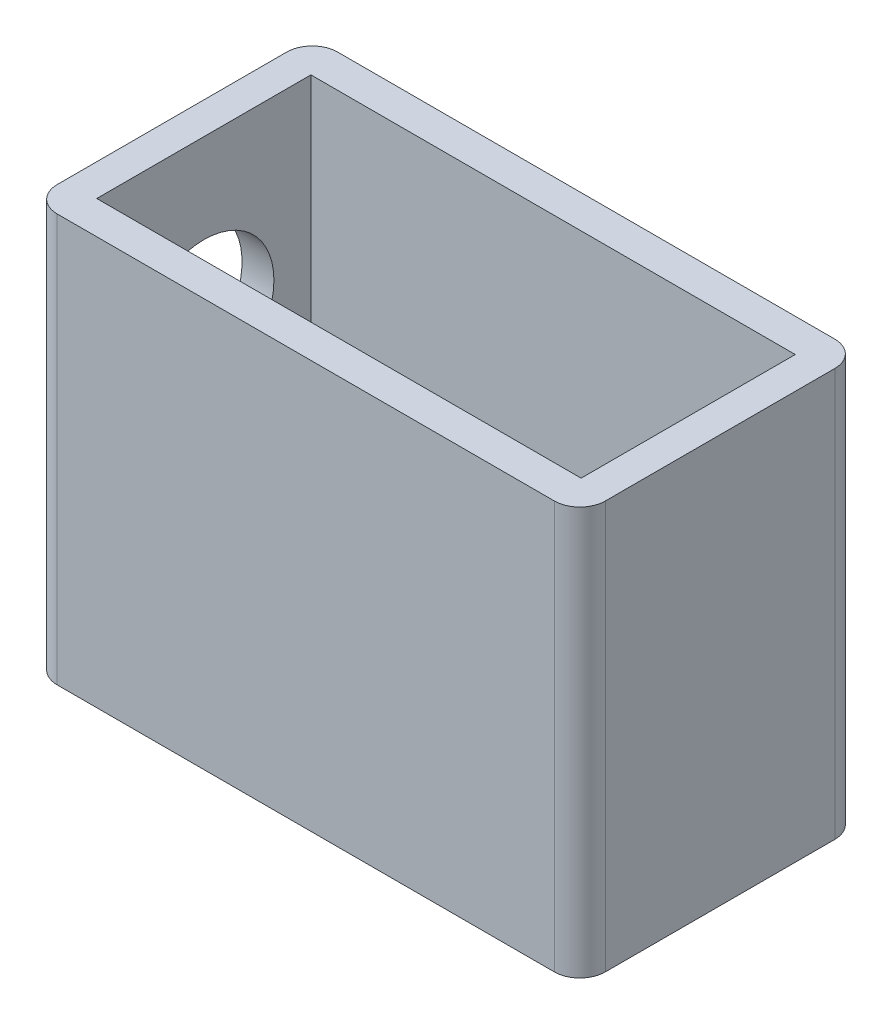
from build123d import *

# Parameters (mm, degrees)
BOSS_EXTRUDE1_DEPTH = 2
SKETCH2_W           = 18.8
SKETCH2_H           = 15.2
SKETCH2_W_2         = 15.8
SKETCH2_H_2         = 15.8
CUT_EXTRUDE1_DEPTH  = 1.4
SKETCH3_W           = 16.8
SKETCH3_H           = 13.2
SKETCH3_W_2         = 13.8
SKETCH3_H_2         = 13.8
CUT_EXTRUDE2_DEPTH  = 25.191114071
BOSS_EXTRUDE3_DEPTH = 30
FILLET1_R           = 10
SKETCH15_W          = 38
SKETCH15_H          = 16.8
CUT_EXTRUDE3_DEPTH  = 39.512984823
CUT_EXTRUDE4_REACH  = 56.717
SKETCH16_R          = 5.5


with BuildPart() as part:
    # Sketch1 → Boss-Extrude1 (new body)
    with BuildSketch(Plane(origin=(0, 0, 0), x_dir=(1, 0, 0), z_dir=(0, 1, 0))):
        with BuildLine():
            Line((19.5, -11), (-19.5, -11))
            ThreePointArc((-19.5, -11), (-20.914213562, -10.414213562), (-21.5, -9))
            Line((-21.5, -9), (-21.5, 9))
            ThreePointArc((-21.5, 9), (-20.914213562, 10.414213562), (-19.5, 11))
            Line((-19.5, 11), (19.5, 11))
            ThreePointArc((19.5, 11), (20.914213562, 10.414213562), (21.5, 9))
            Line((21.5, 9), (21.5, -9))
            ThreePointArc((21.5, -9), (20.914213562, -10.414213562), (19.5, -11))
        make_face()
    extrude(amount=BOSS_EXTRUDE1_DEPTH)

    # Sketch2 → Cut-Extrude1 (cut)
    with BuildSketch(Plane(origin=(0, 2, 0), x_dir=(1, 0, 0), z_dir=(0, 1, 0))):
        with Locations((-8.4, -0.4)):
            Rectangle(SKETCH2_W, SKETCH2_H)
        with Locations((9.9, -0.1)):
            Rectangle(SKETCH2_W_2, SKETCH2_H_2)
    extrude(amount=-CUT_EXTRUDE1_DEPTH, mode=Mode.SUBTRACT)

    # Sketch3 → Cut-Extrude2 (cut, through all)
    with BuildSketch(Plane(origin=(0, 0.6, 0), x_dir=(1, 0, 0), z_dir=(0, 1, 0))):
        with Locations((-8.4, -0.4)):
            Rectangle(SKETCH3_W, SKETCH3_H)
        with Locations((9.9, -0.1)):
            Rectangle(SKETCH3_W_2, SKETCH3_H_2)
    extrude(amount=-CUT_EXTRUDE2_DEPTH, mode=Mode.SUBTRACT)

    # Sketch13 → Boss-Extrude3 (add)
    with BuildSketch(Plane(origin=(0, 2, 0), x_dir=(1, 0, 0), z_dir=(0, 1, 0))):
        with BuildLine():
            ThreePointArc((-21.5, -9), (-20.914213562, -10.414213562), (-19.5, -11))
            Line((-19.5, -11), (19.5, -11))
            ThreePointArc((19.5, -11), (20.914213562, -10.414213562), (21.5, -9))
            Line((21.5, -9), (21.5, 9))
            ThreePointArc((21.5, 9), (20.914213562, 10.414213562), (19.5, 11))
            Line((19.5, 11), (-19.5, 11))
            ThreePointArc((-19.5, 11), (-20.914213562, 10.414213562), (-21.5, 9))
            Line((-21.5, 9), (-21.5, -9))
        make_face()
        with BuildLine():
            ThreePointArc((17.5, 8), (18.207106781, 7.707106781), (18.5, 7))
            Line((18.5, 7), (18.5, -7))
            ThreePointArc((18.5, -7), (18.306225775, -7.591607978), (17.8, -7.953939201))
            Line((17.8, -7.953939201), (17.8, -8))
            Line((17.8, -8), (-17.8, -8))
            Line((-17.8, -8), (-17.8, -7.953939201))
            ThreePointArc((-17.8, -7.953939201), (-18.306225775, -7.591607978), (-18.5, -7))
            Line((-18.5, -7), (-18.5, 7))
            ThreePointArc((-18.5, 7), (-18.207106781, 7.707106781), (-17.5, 8))
            Line((-17.5, 8), (17.5, 8))
        make_face(mode=Mode.SUBTRACT)
    extrude(amount=BOSS_EXTRUDE3_DEPTH)

    # Fillet1
    # the kernel refuses this fillet: 10 mm, written as the material it takes off along each edge
    with BuildSketch(Plane(origin=(17.8, 2, 7.953939201), x_dir=(0.906100611464274, 0, -0.42306226717123885), z_dir=(0, 1, 0))) as fillet1_piece_1:
        with BuildLine():
            CenterArc((1.580945974, -9.912835739), FILLET1_R, 97.570469618, 1.638937345)
            Line((-0.019486586, -0.041735718), (0, 0))
            ThreePointArc((0, 0), (0.131745498, -0.008716426), (0.263490996, 0))
        make_face()
    extrude(amount=30.658727489, mode=Mode.SUBTRACT)

    # Sketch15 → Cut-Extrude3 (cut, through all)
    with BuildSketch(Plane(origin=(0, 2, 0), x_dir=(1, 0, 0), z_dir=(0, 1, 0))):
        Rectangle(SKETCH15_W, SKETCH15_H)
    extrude(amount=CUT_EXTRUDE3_DEPTH, mode=Mode.SUBTRACT)

    # Sketch16 → Cut-Extrude4 (cut, up to next)
    with BuildSketch(Plane.ZY.offset(21.5), mode=Mode.PRIVATE) as cut_extrude4_sk1:
        with Locations((0, 19.5)):
            Circle(SKETCH16_R)
    cut_extrude4_tool1 = extrude(cut_extrude4_sk1.sketch, amount=-CUT_EXTRUDE4_REACH, mode=Mode.PRIVATE) & part.part
    add(cut_extrude4_tool1.solids().sort_by_distance((-21.5, 19.5, 0))[0], mode=Mode.SUBTRACT)


solid = part.part
